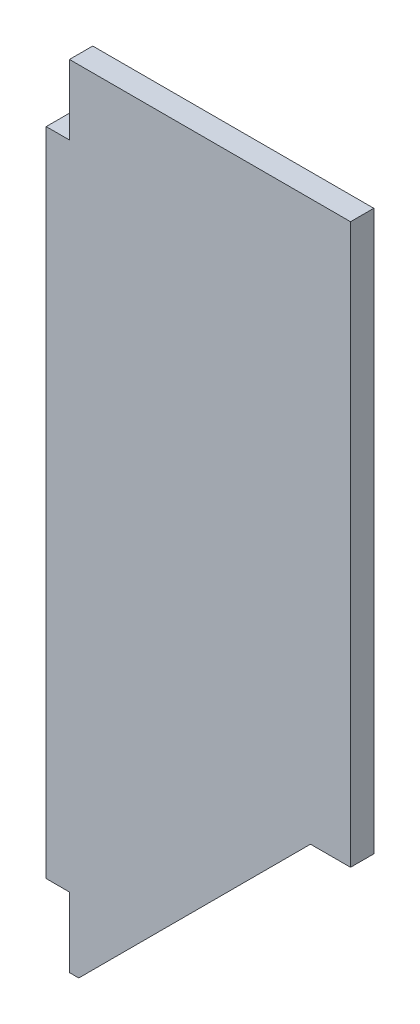
from build123d import *

# Parameters (mm, degrees)
BOSS_EXTRUDE1_DEPTH = 6.35
SKETCH2_W           = 6.35
SKETCH2_H           = 19.05
CUT_EXTRUDE1_DEPTH  = 232.420631821


with BuildPart() as part:
    # Sketch1 → Boss-Extrude1 (new body)
    with BuildSketch(Plane.XY):
        Polygon((0, -215.9), (8.89, -215.9), (72.148675035, -152.641324965), (83.080541238, -152.641324965), (83.080541238, 0), (76.730541238, 0), (0, 0), align=None)
    extrude(amount=BOSS_EXTRUDE1_DEPTH)

    # Sketch2 → Cut-Extrude1 (cut, through all)
    with BuildSketch(Plane.XY.offset(6.35)):
        with Locations((3.175, -9.525)):
            Rectangle(SKETCH2_W, SKETCH2_H)
        with Locations((3.175, -206.375)):
            Rectangle(SKETCH2_W, SKETCH2_H)
    extrude(amount=-CUT_EXTRUDE1_DEPTH, mode=Mode.SUBTRACT)


solid = part.part
